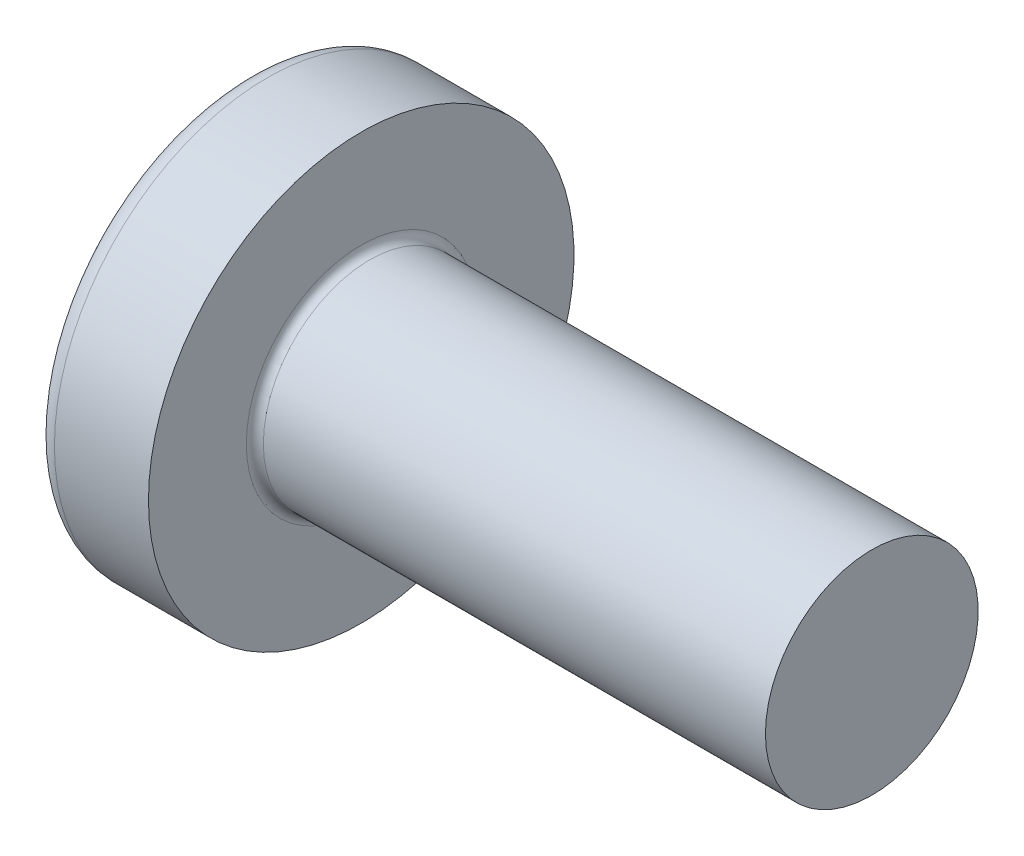
from build123d import *

# Parameters (mm, degrees)
RECPAT_COUNT = 2
RECPAT_ANGLE = 90


with BuildPart() as part:
    # Fillet1: read off the stored shape, not the designer's step
    # Fillet1 outline → Fillet1 (revolve)
    with BuildSketch(Plane.YX):
        with BuildLine():
            Line((1.25, 2.2), (1.25, 8.1))
            Line((1.25, 8.1), (0, 8.1))
            Line((0, 8.1), (0, 0))
            ThreePointArc((0, 0), (1.267435139, 0.206109099), (2.404255321, 0.803195916))
            ThreePointArc((2.404255321, 0.803195916), (2.474733878, 0.88781572), (2.5, 0.99500416))
            Line((2.5, 0.99500416), (2.5, 2.1))
            Line((2.5, 2.1), (1.35, 2.1))
            ThreePointArc((1.35, 2.1), (1.279289322, 2.129289322), (1.25, 2.2))
        make_face()
    revolve(axis=Axis((0, 0, 0), (1, 0, 0)))

    # Sketch3 → Recess section 0
    with BuildSketch(Plane(origin=(0, 0, 0), x_dir=(0, 0, -1), z_dir=(1, 0, 0))):
        with BuildLine():
            Line((0.37, -1.3), (-0.37, -1.3))
            Line((-0.37, -1.3), (-0.37, 1.3))
            Line((-0.37, 1.3), (0.37, 1.3))
            Line((0.37, 1.3), (0.37, -1.3))
        make_face()
    # Sketch4 → Recess section 1
    with BuildSketch(Plane(origin=(1.5, 0, 0), x_dir=(0, 0, -1), z_dir=(1, 0, 0))):
        with BuildLine():
            Line((0.37, -0.552127713), (-0.37, -0.552127713))
            Line((-0.37, -0.552127713), (-0.37, 0.552127713))
            Line((-0.37, 0.552127713), (0.37, 0.552127713))
            Line((0.37, 0.552127713), (0.37, -0.552127713))
        make_face()
    recess = loft(mode=Mode.SUBTRACT)

    # RecPat: Recess ×2 about axis
    recpat_axis = Axis((0, 0, 0), (1, 0, 0))
    for i in range(1, RECPAT_COUNT):
        add(recess.rotate(recpat_axis, i * RECPAT_ANGLE / (RECPAT_COUNT - 1)), mode=Mode.SUBTRACT)

    # RecCorSke → RecessCore (revolve, cut)
    with BuildSketch(Plane.XY, mode=Mode.PRIVATE) as recesscore_sk:
        Polygon((0, 0), (0, 0.660890218), (1.5, 0.556), (1.680655351, 0), align=None)
    revolve(recesscore_sk.sketch.rotate(Axis((-3.175, 0, 0), (1, 0, 0)), 90), axis=Axis((-3.175, 0, 0), (1, 0, 0)), mode=Mode.SUBTRACT)


solid = part.part
